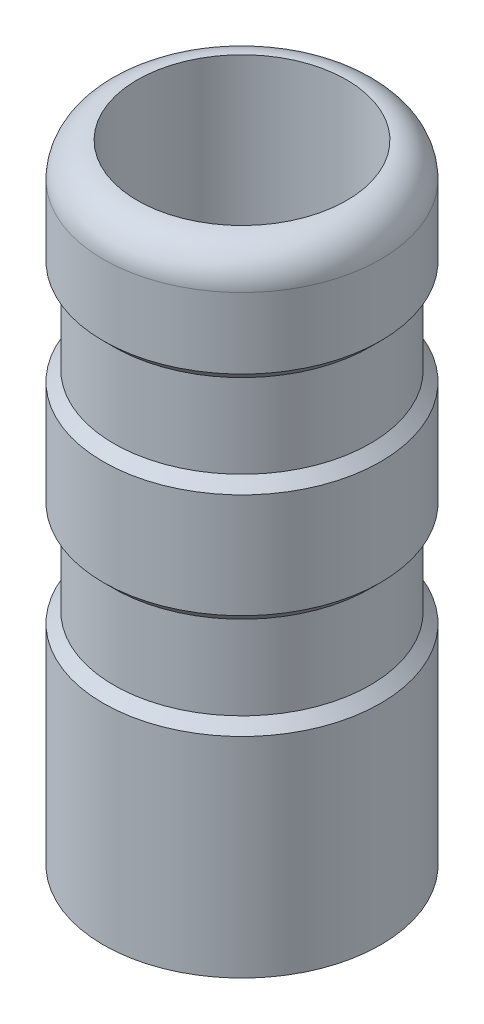
from build123d import *

# Parameters (mm, degrees)
SKETCH1_R           = 16.8275
SKETCH1_R_2         = 12.7
BOSS_EXTRUDE1_DEPTH = 76.2
FILLET1_R           = 4.1275


with BuildPart() as part:
    # Sketch1 → Boss-Extrude1 (new body)
    with BuildSketch(Plane(origin=(0, 0, 0), x_dir=(1, 0, 0), z_dir=(0, 1, 0))):
        with Locations(Location((0, 0, 0), (0, 0, 90))):
            Circle(SKETCH1_R)
        with Locations(Location((0, 0, 0), (0, 0, 90))):
            Circle(SKETCH1_R_2, mode=Mode.SUBTRACT)
    extrude(amount=BOSS_EXTRUDE1_DEPTH)

    # Fillet1
    fillet1_edges = [part.edges().sort_by_distance(p)[0] for p in [
        (0, 76.2, 16.8275),
    ]]
    fillet(fillet1_edges, radius=FILLET1_R - 0.0001)  # a hair under: the kernel refuses the full size

    # Sketch2 → Cut-Revolve1 (revolve, cut)
    with BuildSketch(Plane.XY, mode=Mode.PRIVATE) as cut_revolve1_sk:
        Polygon((16.8275, 63.5), (15.5575, 62.23), (15.5575, 52.07), (16.8275, 50.8), align=None)
        Polygon((16.8275, 38.1), (15.5575, 36.83), (15.5575, 26.67), (16.8275, 25.4), align=None)
    revolve(cut_revolve1_sk.sketch.rotate(Axis((0, 0, 0), (0, 1, 0)), 90), axis=Axis((0, 0, 0), (0, 1, 0)), mode=Mode.SUBTRACT)


solid = part.part
